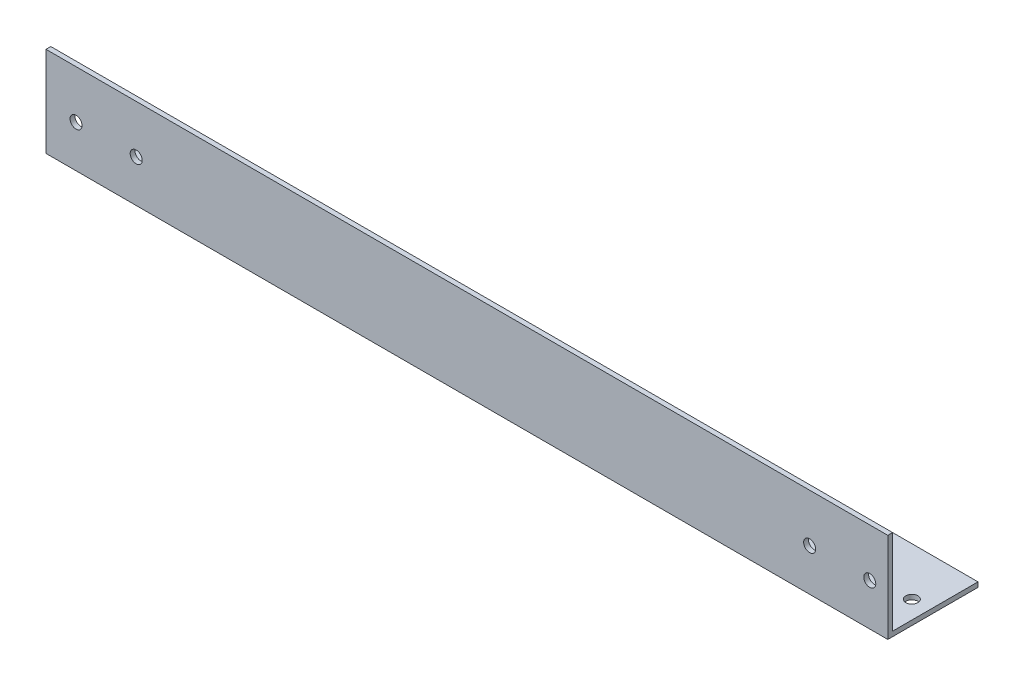
from build123d import *

# Parameters (mm, degrees)
EXTRUDE_1_DEPTH     = 700
SKETCH_2_R          = 5
CUT_EXTRUDE_1_DEPTH = 10
SKETCH_3_R          = 5
CUT_EXTRUDE_2_DEPTH = 10


with BuildPart() as part:
    # Эскиз1 → Вытянуть-Тонкостенный1 (new body)
    with BuildSketch(Plane(origin=(0, 0, 0), x_dir=(0, 0, -1), z_dir=(1, 0, 0))):
        Polygon((75, 0), (0, 0), (0, 75), (4, 75), (4, 4), (75, 4), align=None)
    extrude(amount=EXTRUDE_1_DEPTH)

    # Эскиз2 → Вырез-Вытянуть1 (cut)
    with BuildSketch(Plane.XY):
        with Locations((25, 35)):
            Circle(SKETCH_2_R)
        with Locations((75, 35)):
            Circle(SKETCH_2_R)
        with Locations((635, 35)):
            Circle(SKETCH_2_R)
        with Locations((685, 35)):
            Circle(SKETCH_2_R)
    extrude(amount=-CUT_EXTRUDE_1_DEPTH, mode=Mode.SUBTRACT)

    # Эскиз3 → Вырез-Вытянуть2 (cut)
    with BuildSketch(Plane.XZ):
        with Locations((25, -35)):
            Circle(SKETCH_3_R)
        with Locations((75, -35)):
            Circle(SKETCH_3_R)
        with Locations((635, -35)):
            Circle(SKETCH_3_R)
        with Locations((685, -35)):
            Circle(SKETCH_3_R)
    extrude(amount=-CUT_EXTRUDE_2_DEPTH, mode=Mode.SUBTRACT)


solid = part.part
